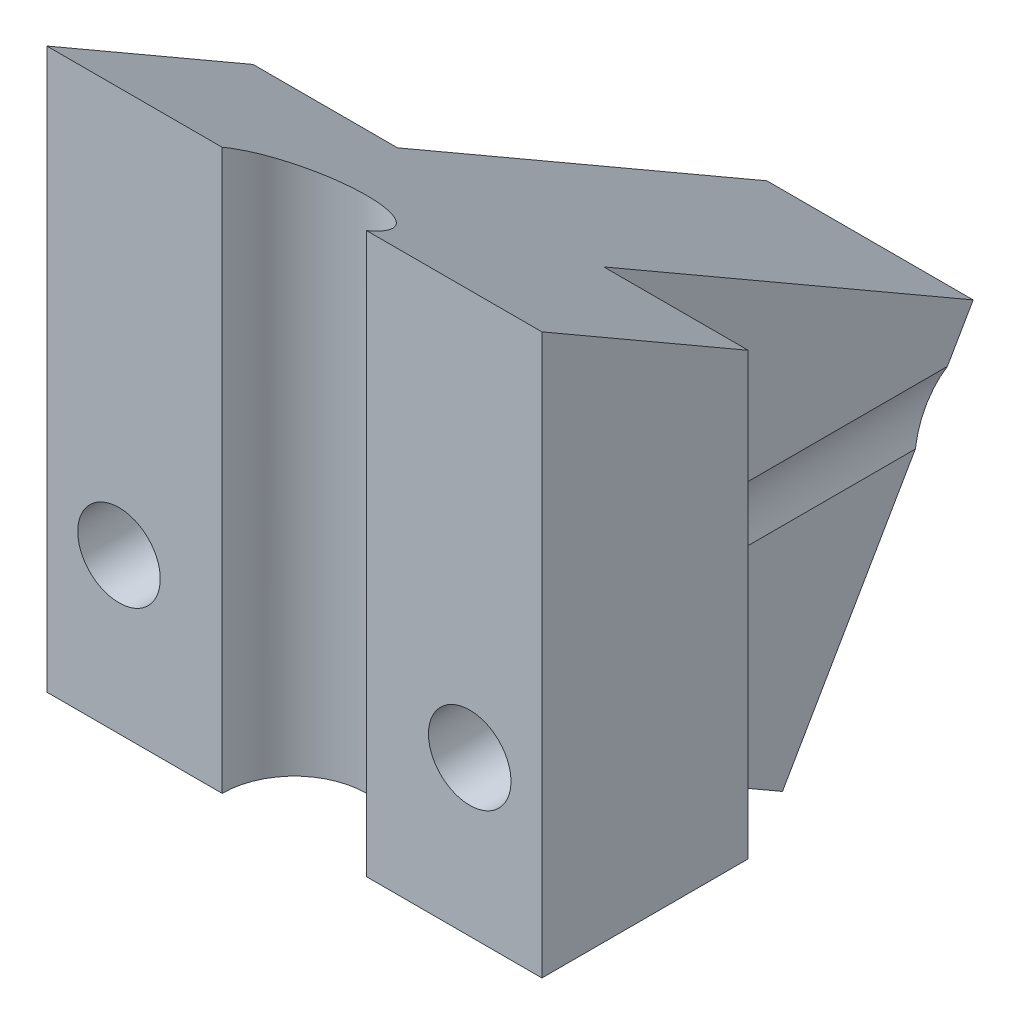
from build123d import *

# Parameters (mm, degrees)
SKETCH_1_W              = 48
SKETCH_1_H              = 20
EXTRUDE_1_DEPTH         = 30
SKETCH_2_W              = 14
SKETCH_2_H              = 30
CUT_EXTRUDE_1_DEPTH     = 7
EXTRUDE_2_DEPTH         = 48
CUT_EXTRUDE_2_DEPTH     = 14
CUT_EXTRUDE_3_DEPTH     = 14
CUT_EXTRUDE_4_DEPTH     = 65.456478054
SKETCH_13_R             = 4
CUT_EXTRUDE_5_DEPTH     = 53.52066051
SKETCH_14_R             = 4
CUT_EXTRUDE_6_DEPTH     = 53.52066051
FILLET_1_R              = 7
EXTRUDE_3_DEPTH         = 3
EXTRUDE_5_DEPTH         = 1
SKETCH_20_R             = 7.5
CUT_EXTRUDE_8_DEPTH     = 53.520660579
BOSS_EXTRUDE1_DEPTH     = 25
CUT_EXTRUDE1_DEPTH      = 80.244164279
CUT_EXTRUDE1_DEPTH_BACK = 80.244164279


with BuildPart() as part:
    # Эскиз1 → Бобышка-Вытянуть1 (new body)
    with BuildSketch(Plane(origin=(0, 0, 0), x_dir=(1, 0, 0), z_dir=(0, 1, 0))):
        Rectangle(SKETCH_1_W, SKETCH_1_H)
    extrude(amount=EXTRUDE_1_DEPTH)

    # Эскиз2 → Вырез-Вытянуть1 (cut)
    with BuildSketch(Plane.XY.offset(10)):
        with Locations((0, 15)):
            Rectangle(SKETCH_2_W, SKETCH_2_H)
    extrude(amount=-CUT_EXTRUDE_1_DEPTH, mode=Mode.SUBTRACT)

    # Эскиз7 → Бобышка-Вытянуть2 (add)
    with BuildSketch(Plane(origin=(24, 0, 0), x_dir=(0, 0, -1), z_dir=(1, 0, 0))):
        Polygon((10, 0), (27.320508076, -10), (45.810889132, 22.026279442), (32, 30), (10, 30), align=None)
    extrude(amount=-EXTRUDE_2_DEPTH)

    # Эскиз8 → Вырез-Вытянуть2 (cut)
    with BuildSketch(Plane(origin=(24, 0, 0), x_dir=(0, 0, -1), z_dir=(1, 0, 0))):
        Polygon((10, 0), (10, 30), (32, 30), (45.810889132, 22.026279442), (27.320508076, -10), align=None)
    extrude(amount=-CUT_EXTRUDE_2_DEPTH, mode=Mode.SUBTRACT)

    # Эскиз9 → Вырез-Вытянуть3 (cut)
    with BuildSketch(Plane.ZY.offset(24)):
        Polygon((-10, 0), (-10, 30), (-32, 30), (-45.810889132, 22.026279442), (-27.320508076, -10), align=None)
    extrude(amount=-CUT_EXTRUDE_3_DEPTH, mode=Mode.SUBTRACT)

    # Эскиз11 → Вырез-Вытянуть4 (cut, through all)
    with BuildSketch(Plane.ZY.offset(10)):
        Polygon((-17.085266521, 5.482226936), (-27.285266521, 23.149145173), (-36.291930721, 17.949145173), (-26.091930721, 0.282226936), align=None)
    extrude(amount=-CUT_EXTRUDE_4_DEPTH, mode=Mode.SUBTRACT)

    # Эскиз13 → Вырез-Вытянуть5 (cut, through all)
    with BuildSketch(Plane(origin=(0, 0, -10), x_dir=(-1, 0, 0), z_dir=(0, 0, -1))):
        with Locations((17, 15)):
            Circle(SKETCH_13_R)
    extrude(amount=-CUT_EXTRUDE_5_DEPTH, mode=Mode.SUBTRACT)

    # Эскиз14 → Вырез-Вытянуть6 (cut, through all)
    with BuildSketch(Plane(origin=(0, 0, -10), x_dir=(-1, 0, 0), z_dir=(0, 0, -1))):
        with Locations((-17, 15)):
            Circle(SKETCH_14_R)
    extrude(amount=-CUT_EXTRUDE_6_DEPTH, mode=Mode.SUBTRACT)

    # Скругление1
    fillet_1_edges = [part.edges().sort_by_distance(p)[0] for p in [
        (-7, 15, 3),
        (7, 15, 3),
    ]]
    fillet(fillet_1_edges, radius=FILLET_1_R - 0.0001)  # a hair under: the kernel refuses the full size

    # Эскиз16 → Бобышка-Вытянуть3 (add)
    with BuildSketch(Plane(origin=(10, 0, 0), x_dir=(0, 0, -1), z_dir=(1, 0, 0))):
        Polygon((27.285266521, 23.149145173), (17.085266521, 5.482226936), (26.091930721, 0.282226936), (36.291930721, 17.949145173), align=None)
    extrude(amount=-EXTRUDE_3_DEPTH)

    # Эскиз18 → Бобышка-Вытянуть5 (add)
    with BuildSketch(Plane(origin=(0, -14.330127019, -24.820508076), x_dir=(-1, 0, 0), z_dir=(0, -0.4999999999999885, -0.8660254037844454))):
        with BuildLine():
            Line((3.076923077, 23.490381057), (3.076923077, 15.490381057))
            Line((3.076923077, 15.490381057), (-0.394230769, 15.490381057))
            add(Edge.make_bspline(
                [(-0.394230769, 15.490381057), (-0.475966203, 15.49101845), (-0.634155568, 15.49225205), (-0.863556464, 15.501067061), (-1.077173272, 15.519794557), (-1.276352297, 15.540710881), (-1.460752713, 15.571594241), (-1.630462401, 15.607825992), (-1.784830485, 15.650647709), (-1.925031539, 15.701264755), (-2.055118116, 15.758511595), (-2.175664232, 15.829183977), (-2.291845901, 15.906492451), (-2.399031866, 15.998074814), (-2.502049745, 16.096470161), (-2.596586483, 16.206601733), (-2.685439891, 16.325713037), (-2.793473896, 16.498197991), (-2.906939016, 16.729401784), (-3.004668447, 17.02314385), (-3.06681146, 17.330727068), (-3.073519576, 17.5408315), (-3.076923077, 17.647432339)],
                knots=[0, 0, 0, 0, 1.242075696, 2.40389213, 3.487198984, 4.500157661, 5.446319301, 6.326791195, 7.136300648, 7.878370406, 8.590488565, 9.292260633, 9.999224673, 10.708050372, 11.431369221, 12.162165018, 12.910600795, 13.687589445, 15.252257874, 16.810406251, 18.381693487, 20, 20, 20, 20], degree=3))
            add(Edge.make_bspline(
                [(-3.076923077, 17.647432339), (-3.075357604, 17.715865612), (-3.072265688, 17.851026019), (-3.048581646, 18.049748215), (-3.005726368, 18.239618444), (-2.950775925, 18.42230348), (-2.87555432, 18.595200652), (-2.788453183, 18.761894703), (-2.680395045, 18.917607923), (-2.559742342, 19.067544403), (-2.419445088, 19.204937793), (-2.263386964, 19.331922341), (-2.086876234, 19.440896432), (-1.89570213, 19.542168691), (-1.684937787, 19.625339579), (-1.457761732, 19.698574242), (-1.21241575, 19.755040234), (-1.042362796, 19.783482773), (-0.955128205, 19.798073364)],
                knots=[0, 0, 0, 0, 0.982645791, 1.940792824, 2.867691729, 3.775150443, 4.675643875, 5.571354211, 6.471357401, 7.392684514, 8.331098131, 9.285922955, 10.275520706, 11.304845665, 12.388884831, 13.524255008, 14.729980297, 16, 16, 16, 16], degree=3))
            add(Edge.make_bspline(
                [(-0.955128205, 19.798073364), (-1.019738399, 19.830278555), (-1.14226585, 19.891352818), (-1.308999482, 19.992404668), (-1.455065559, 20.087536339), (-1.53803712, 20.158871679), (-1.576923077, 20.192304134)],
                knots=[0, 0, 0, 0, 1.172551213, 2.223638478, 3.167479604, 4, 4, 4, 4], degree=3))
            add(Edge.make_bspline(
                [(-1.576923077, 20.192304134), (-1.652624383, 20.266285408), (-1.807875296, 20.418008818), (-2.019735444, 20.678834883), (-2.229368535, 20.965668904), (-2.355227865, 21.174690137), (-2.419871795, 21.282047723)],
                knots=[0, 0, 0, 0, 0.918170575, 1.883016652, 2.912673989, 4, 4, 4, 4], degree=3))
            Line((-2.419871795, 21.282047723), (-3.732371795, 23.490381057))
            Line((-3.732371795, 23.490381057), (-2.439102564, 23.490381057))
            Line((-2.439102564, 23.490381057), (-1.442307692, 21.801278493))
            add(Edge.make_bspline(
                [(-1.442307692, 21.801278493), (-1.406465761, 21.74201577), (-1.337009983, 21.627174345), (-1.236719552, 21.459429826), (-1.138255761, 21.30508177), (-1.047376022, 21.15932531), (-0.958316878, 21.02600434), (-0.878481314, 20.900073272), (-0.798305584, 20.788666158), (-0.706246053, 20.654823189), (-0.593818414, 20.510114732), (-0.462623309, 20.361457059), (-0.34199814, 20.238315643), (-0.18956943, 20.120822362), (-3.2323e-05, 20.013245791), (0.159774488, 19.962214344), (0.237179487, 19.937496441)],
                knots=[0, 0, 0, 0, 1.130591283, 2.190900266, 3.190104209, 4.119071823, 4.994606968, 5.807262858, 6.55236009, 7.234593472, 8.459046683, 9.540234366, 10.471327768, 11.266723835, 12.676093724, 14, 14, 14, 14], degree=3))
            add(Edge.make_bspline(
                [(0.237179487, 19.937496441), (0.269697183, 19.931632396), (0.343936058, 19.918244603), (0.469993483, 19.909501015), (0.622727518, 19.900220866), (0.733416476, 19.900491258), (0.793269231, 19.900637467)],
                knots=[0, 0, 0, 0, 0.709978628, 1.620902492, 2.713552433, 4, 4, 4, 4], degree=3))
            Line((0.793269231, 19.900637467), (1.948717949, 19.900637467))
            Line((1.948717949, 19.900637467), (1.948717949, 23.490381057))
            Line((1.948717949, 23.490381057), (3.076923077, 23.490381057))
        make_face()
        with BuildLine():
            Line((1.948717949, 18.977560544), (-0.193910256, 18.977560544))
            add(Edge.make_bspline(
                [(-0.193910256, 18.977560544), (-0.301354607, 18.97589409), (-0.502211742, 18.972778811), (-0.783007271, 18.945769758), (-1.023200158, 18.903550736), (-1.225858519, 18.839427155), (-1.396173113, 18.753553027), (-1.54378517, 18.648537277), (-1.667901131, 18.51825252), (-1.769975791, 18.368861713), (-1.849770319, 18.206056724), (-1.90552669, 18.03374763), (-1.942959563, 17.855238544), (-1.946787014, 17.733092852), (-1.948717949, 17.6714708)],
                knots=[0, 0, 0, 0, 1.546056516, 2.890207646, 4.055830773, 5.050253158, 5.937355789, 6.790906573, 7.644595853, 8.512568064, 9.38593768, 10.244184789, 11.114197691, 12, 12, 12, 12], degree=3))
            add(Edge.make_bspline(
                [(-1.948717949, 17.6714708), (-1.947235583, 17.626563151), (-1.944332064, 17.538602257), (-1.928948857, 17.409542216), (-1.89968097, 17.287236957), (-1.859266003, 17.17080484), (-1.808094758, 17.059993077), (-1.745213393, 16.955237495), (-1.670946372, 16.857073145), (-1.585753391, 16.765016757), (-1.487970747, 16.681241729), (-1.376270424, 16.608965458), (-1.251544399, 16.547545272), (-1.113644587, 16.498798364), (-0.963006292, 16.459808698), (-0.798771701, 16.43387015), (-0.621691971, 16.415101097), (-0.498985984, 16.414015918), (-0.435897436, 16.41345798)],
                knots=[0, 0, 0, 0, 0.965235723, 1.89061323, 2.787065514, 3.661873922, 4.534873316, 5.404925039, 6.281839248, 7.175200054, 8.095223355, 9.040740021, 10.02630299, 11.075573487, 12.177989335, 13.364883635, 14.645170704, 16, 16, 16, 16], degree=3))
            Line((-0.435897436, 16.41345798), (1.948717949, 16.41345798))
            Line((1.948717949, 16.41345798), (1.948717949, 18.977560544))
        make_face(mode=Mode.SUBTRACT)
    extrude(amount=EXTRUDE_5_DEPTH)

    # Эскиз20 → Вырез-Вытянуть8 (cut, through all)
    with BuildSketch(Plane(origin=(0, 0, -10), x_dir=(-1, 0, 0), z_dir=(0, 0, -1))):
        with Locations((-17, 15)):
            Circle(SKETCH_20_R)
        with Locations((17, 15)):
            Circle(SKETCH_20_R)
    extrude(amount=CUT_EXTRUDE_8_DEPTH, mode=Mode.SUBTRACT)

    # Sketch3 → Boss-Extrude1 (add)
    with BuildSketch(Plane(origin=(0, 30, 0), x_dir=(1, 0, 0), z_dir=(0, 1, 0))):
        with BuildLine():
            Line((7, -10), (24, -10))
            Line((24, -10), (24, 10))
            Line((24, 10), (10, 10))
            Line((10, 10), (10, 32))
            Line((10, 32), (-10, 32))
            Line((-10, 32), (-10, 10))
            Line((-10, 10), (-24, 10))
            Line((-24, 10), (-24, -10))
            Line((-24, -10), (-7, -10))
            ThreePointArc((-7, -10), (0, -3), (7, -10))
        make_face()
    extrude(amount=BOSS_EXTRUDE1_DEPTH)

    # Sketch4 → Cut-Extrude1 (cut, two sides: drawn at the far end of the back side and taken through both)
    with BuildSketch(Plane.ZY.offset(10).offset(-CUT_EXTRUDE1_DEPTH_BACK)):
        Polygon((-251.050138586, -96.468656479), (-45.810889132, 22.026279442), (35.63071017, 69.046608722), (240.869959624, 187.541544642), (3.880087783, 598.020043549), (-488.040010426, 314.009842428), align=None)
    extrude(amount=CUT_EXTRUDE1_DEPTH + CUT_EXTRUDE1_DEPTH_BACK, mode=Mode.SUBTRACT)


solid = part.part
